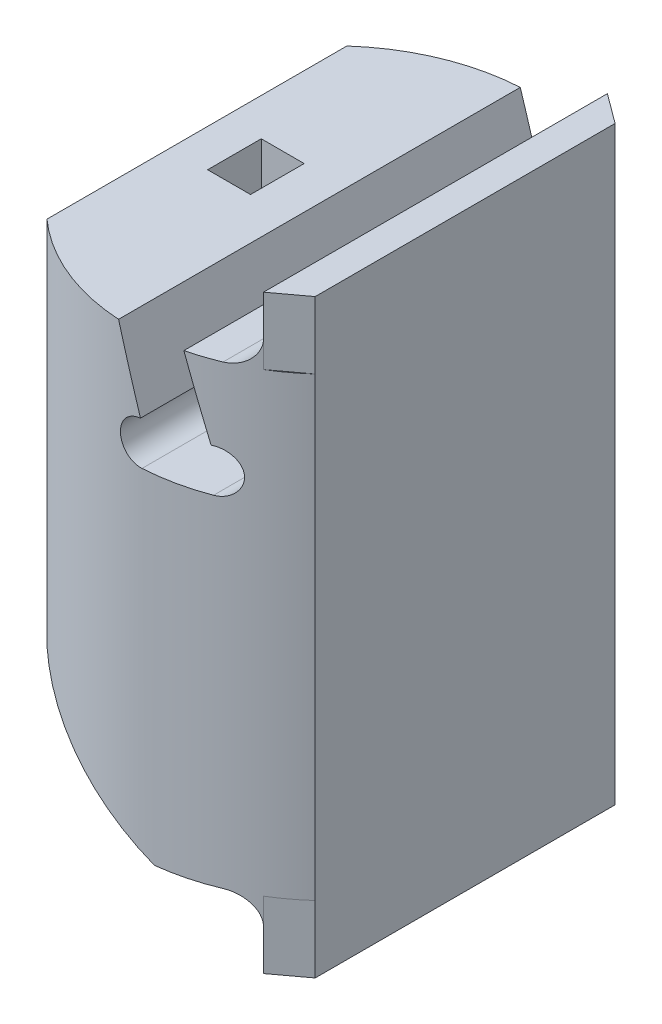
from build123d import *

# Parameters (mm, degrees)
SKETCH1_W               = 7.5
SKETCH1_H               = 17
CUT_EXTRUDE1_START      = -20
CUT_EXTRUDE1_DEPTH      = 20
SKETCH4_W               = 1.6
SKETCH4_H               = 2
CUT_EXTRUDE2_DEPTH      = 20
CUT_EXTRUDE3_DEPTH      = 13.389511693
CUT_EXTRUDE3_DEPTH_BACK = 13.389511693
CUT_EXTRUDE4_DEPTH      = 13.389511863
CUT_EXTRUDE4_DEPTH_BACK = 13.389511863
BOSS_EXTRUDE4_DEPTH     = 2.5
FILLET1_R               = 1
BOSS_EXTRUDE7_DEPTH     = 2.5
FILLET5_R               = 1


with BuildPart() as part:
    # Sketch1 → Revolve1 (revolve)
    with BuildSketch(Plane.XY):
        with Locations((-3.75, 0)):
            Rectangle(SKETCH1_W, SKETCH1_H)
    revolve(axis=Axis((0, 8.5, 0), (0, -1, 0)))

    # Sketch2 → Cut-Extrude1 (cut)
    with BuildSketch(Plane.XZ.offset(8.5).offset(CUT_EXTRUDE1_START)):
        with BuildLine():
            Line((-5, 5.590169944), (-5, -5.590169944))
            ThreePointArc((-5, -5.590169944), (-7.5, 0), (-5, 5.590169944))
        make_face()
    cut_extrude1 = extrude(amount=CUT_EXTRUDE1_DEPTH, mode=Mode.SUBTRACT)

    # Sketch4 → Cut-Extrude2 (cut)
    with BuildSketch(Plane.XZ.offset(8.5)):
        with Locations((-2.8, 0)):
            Rectangle(SKETCH4_W, SKETCH4_H)
    extrude(amount=-CUT_EXTRUDE2_DEPTH, mode=Mode.SUBTRACT)

    # Mirror1: Cut-Extrude1 across plane
    add(cut_extrude1.mirror(Plane(origin=(0, 0, 0), x_dir=(0, 0, 1), z_dir=(1, 0, 0))), mode=Mode.SUBTRACT)

    # Sketch7 → Cut-Extrude3 (cut, two sides: drawn at the far end of the back side and taken through both)
    with BuildSketch(Plane.XY.offset(-CUT_EXTRUDE3_DEPTH_BACK)):
        with BuildLine():
            Line((0.441294084, 4.12121402), (2.641294084, 4.12121402))
            ThreePointArc((2.641294084, 4.12121402), (2.930486649, 4.17531345), (3.180566332, 4.330294869))
            ThreePointArc((3.180566332, 4.330294869), (3.374330031, 5.241617362), (2.573852958, 5.718366261))
            Line((2.573852958, 5.718366261), (1.796324142, 8.5))
            Line((1.796324142, 8.5), (-0.431632782, 8.5))
            Line((-0.431632782, 8.5), (0.38797004, 5.719434883))
            ThreePointArc((0.38797004, 5.719434883), (-0.156844774, 5.452467167), (-0.357641011, 4.879950081))
            ThreePointArc((-0.357641011, 4.879950081), (-0.109609196, 4.341123014), (0.441294084, 4.12121402))
        make_face()
    extrude(amount=CUT_EXTRUDE3_DEPTH + CUT_EXTRUDE3_DEPTH_BACK, mode=Mode.SUBTRACT)

    # Sketch8 → Cut-Extrude4 (cut, two sides: drawn at the far end of the back side and taken through both)
    with BuildSketch(Plane.XY.offset(-CUT_EXTRUDE4_DEPTH_BACK)):
        Polygon((-5, -5.268946984), (0.867668731, -8.5), (-5, -8.5), align=None)
    extrude(amount=CUT_EXTRUDE4_DEPTH + CUT_EXTRUDE4_DEPTH_BACK, mode=Mode.SUBTRACT)

    # Sketch13 → Boss-Extrude4 (add)
    with BuildSketch(Plane(origin=(0, 8.5, 0), x_dir=(1, 0, 0), z_dir=(0, 1, 0))):
        Polygon((5, 5.590169944), (5, -5.590169944), (3.894868524, -6.40936808), (3.894868524, 6.40936808), align=None)
    extrude(amount=BOSS_EXTRUDE4_DEPTH)

    # Fillet1
    # the kernel refuses this fillet: 1 mm, written as the material it adds along each edge
    with BuildSketch(Plane(origin=(3.894868524, 8.5, 8.90936808), x_dir=(-1, 0, 0), z_dir=(0, 0, -1))) as fillet1_piece_1_section:
        with BuildLine():
            CenterArc((FILLET1_R, FILLET1_R), FILLET1_R, 180, 90)
            Line((0, FILLET1_R), (0, 0))
            Line((0, 0), (FILLET1_R, 0))
        make_face()
    fillet1_piece_1 = extrude(amount=17.81873616, mode=Mode.PRIVATE)
    fillet1_piece_1 = fillet1_piece_1 & Plane(origin=(0, 8.724088474, 0), x_dir=(-1, 0, 0), z_dir=(0, 1, 0)) * Cylinder(7.5, 40, mode=Mode.PRIVATE)
    fillet1_piece_1 = split(fillet1_piece_1, bisect_by=Plane(origin=(6.812525482, 8.724088474, 4.246603564), z_dir=(-0.5955008037670206, -6.20137611558393e-15, -0.8033547116391566)), keep=Keep.TOP, mode=Mode.PRIVATE)
    add(fillet1_piece_1)

    # Sketch15 → Boss-Extrude7 (add)
    with BuildSketch(Plane.XZ.offset(8.5)):
        Polygon((5, 5.590169944), (5, -5.590169944), (3.894868524, -6.40936808), (3.894868524, 6.40936808), align=None)
    extrude(amount=BOSS_EXTRUDE7_DEPTH)

    # Fillet5
    # the kernel refuses this fillet: 1 mm, written as the material it adds along each edge
    with BuildSketch(Plane(origin=(3.894868524, -8.5, -8.90936808), x_dir=(-1, 0, 0), z_dir=(0, 0, 1))) as fillet5_piece_1_section:
        with BuildLine():
            CenterArc((FILLET5_R, FILLET5_R), FILLET5_R, 180, 90)
            Line((0, FILLET5_R), (0, 0))
            Line((0, 0), (FILLET5_R, 0))
        make_face()
    fillet5_piece_1 = extrude(amount=17.81873616, mode=Mode.PRIVATE)
    fillet5_piece_1 = fillet5_piece_1 & Plane(origin=(0, -8.724088474, 0), x_dir=(-1, 0, 0), z_dir=(0, 1, 0)) * Cylinder(7.5, 40, mode=Mode.PRIVATE)
    fillet5_piece_1 = split(fillet5_piece_1, bisect_by=Plane(origin=(6.812525482, -8.724088474, -4.246603564), z_dir=(-0.5955008037671681, -6.201376115585466e-15, 0.8033547116390474)), keep=Keep.TOP, mode=Mode.PRIVATE)
    add(fillet5_piece_1)


solid = part.part
